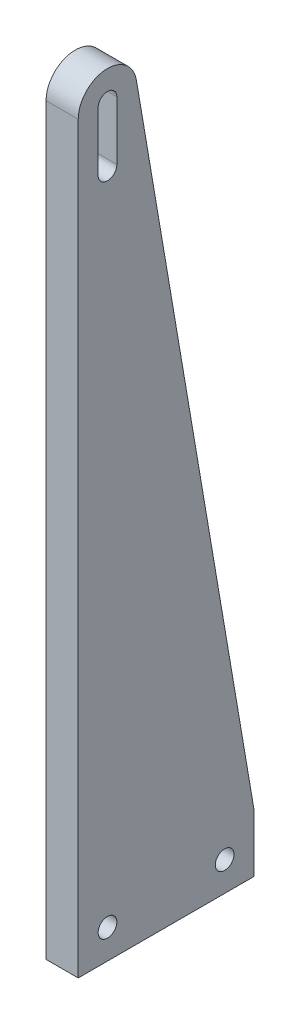
from build123d import *

# Parameters (mm, degrees)
SKETCH1_R           = 1.6
BOSS_EXTRUDE1_DEPTH = 5.4864


with BuildPart() as part:
    # Sketch1 → Boss-Extrude1 (new body)
    with BuildSketch(Plane(origin=(0, 0, 0), x_dir=(0, 0, -1), z_dir=(1, 0, 0))):
        with BuildLine():
            Line((0, 0), (30, 0))
            Line((30, 0), (30, 10))
            Line((30, 10), (9.929014537, 127.839533021))
            ThreePointArc((9.929014537, 127.839533021), (4.578735644, 131.982222029), (0, 127))
            Line((0, 127), (0, 0))
        make_face()
        with Locations((5, 5)):
            Circle(SKETCH1_R, mode=Mode.SUBTRACT)
        with Locations((25, 5)):
            Circle(SKETCH1_R, mode=Mode.SUBTRACT)
        with BuildLine():
            Line((3.4, 117), (3.4, 127))
            ThreePointArc((3.4, 127), (5, 128.6), (6.6, 127))
            Line((6.6, 127), (6.6, 117))
            ThreePointArc((6.6, 117), (5, 115.4), (3.4, 117))
        make_face(mode=Mode.SUBTRACT)
    extrude(amount=BOSS_EXTRUDE1_DEPTH)


solid = part.part
